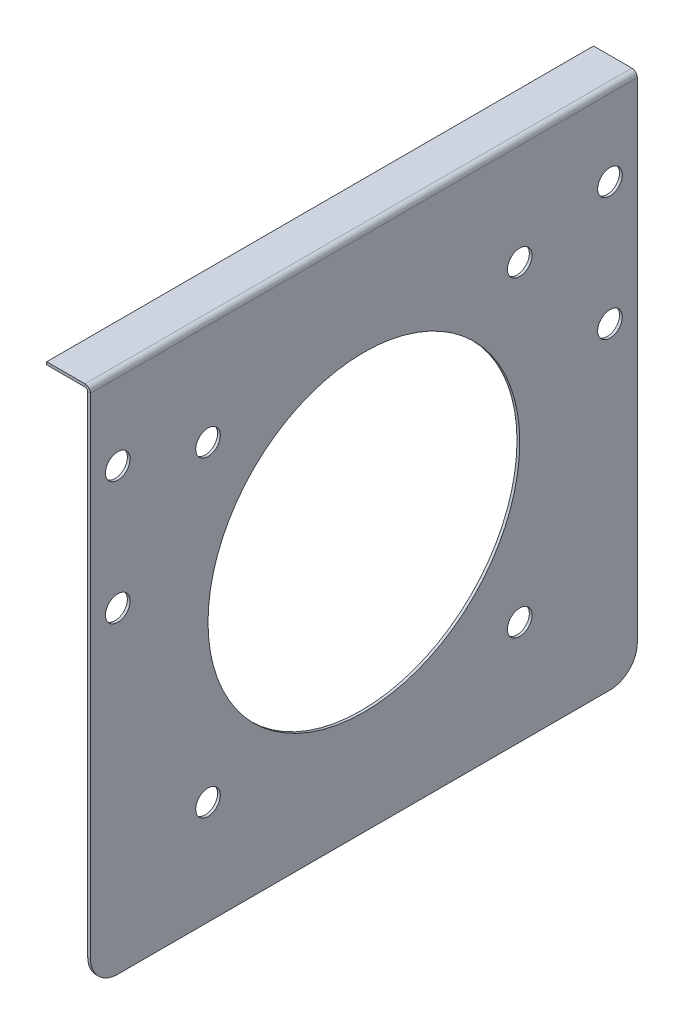
from build123d import *

# Parameters (mm, degrees)
CROQUIS1_R                       = 57
SALIENTE_EXTRUIR1_DEPTH          = 15
VACIADO1_T                       = 1
DESPLEGAR_PLIEGUES1_OUTLINE_W    = 1
DESPLEGAR_PLIEGUES1_OUTLINE_H    = 200
DESPLEGAR_PLIEGUES1_DEPTH        = 15
DESPLEGAR_START                  = 15
DESPLEGAR_PLIEGUES1_2_OUTLINE_W  = 14.35619449
DESPLEGAR_PLIEGUES1_2_OUTLINE_H  = 200
DESPLEGAR_PLIEGUES1_2_DEPTH      = 1
PROCESAR_START                   = -100
PROCESAR_PLIEGUES1_DEPTH         = 200
PROCESAR_PLIEGUES1_2_DEPTH       = 200
TALADRO_DE_MARGEN_PARA_M83_D     = 9
TALADRO_DE_MARGEN_PARA_M84_D     = 9
TALADRO_DE_MARGEN_PARA_M84_DEPTH = 15.42
TALADRO_DE_MARGEN_PARA_M85_D     = 9
TALADRO_DE_MARGEN_PARA_M85_DEPTH = 1.999


# Read off the part's stored shape, not the designer's step: Desplegar pliegues1, Procesar pliegues1
with BuildPart() as part:
    # Croquis1 → Saliente-Extruir1 (new body)
    with BuildSketch(Plane(origin=(0, 0, 0), x_dir=(0, 0, -1), z_dir=(1, 0, 0))):
        with BuildLine():
            Line((-100, 0), (100, 0))
            Line((100, 0), (100, -180))
            ThreePointArc((100, -180), (97.071067812, -187.071067812), (90, -190))
            Line((90, -190), (-90, -190))
            ThreePointArc((-90, -190), (-97.071067812, -187.071067812), (-100, -180))
            Line((-100, -180), (-100, 0))
        make_face()
        with Locations((0, -95)):
            Circle(CROQUIS1_R, mode=Mode.SUBTRACT)
    extrude(amount=SALIENTE_EXTRUIR1_DEPTH)

    # Vaciado1
    vaciado1_openings = [part.faces().sort_by_distance(p)[0] for p in [
        (7.5, -90, -100),
        (7.5, -187.071067812, -97.071067812),
        (7.5, -190, 0),
        (7.5, -187.071067812, 97.071067812),
        (7.5, -90, 100),
        (7.5, -95, 57),
        (0, -2.758622845, 0),
    ]]
    offset(amount=VACIADO1_T, openings=vaciado1_openings, kind=Kind.INTERSECTION)

    # Desplegar pliegues1 outline → Desplegar pliegues1 (cut)
    with BuildSketch(Plane.YZ):
        with Locations((0.5, 0)):
            Rectangle(DESPLEGAR_PLIEGUES1_OUTLINE_W, DESPLEGAR_PLIEGUES1_OUTLINE_H)
    extrude(amount=DESPLEGAR_PLIEGUES1_DEPTH, mode=Mode.SUBTRACT)

    # Desplegar pliegues1 2 outline → Desplegar pliegues1 2 (add)
    with BuildSketch(Plane.YZ.offset(DESPLEGAR_START)):
        with Locations((8.178097245, 0)):
            Rectangle(DESPLEGAR_PLIEGUES1_2_OUTLINE_W, DESPLEGAR_PLIEGUES1_2_OUTLINE_H)
    extrude(amount=DESPLEGAR_PLIEGUES1_2_DEPTH)

    # Procesar pliegues1 outline → Procesar pliegues1 (cut)
    with BuildSketch(Plane.XY.offset(PROCESAR_START)):
        with BuildLine():
            Line((15, 15.35619449), (15, 0.732050807))
            ThreePointArc((15, 0.732050807), (15.732050807, 0), (16, -1))
            Line((16, -1), (16, 15.35619449))
            Line((16, 15.35619449), (15, 15.35619449))
        make_face()
    extrude(amount=PROCESAR_PLIEGUES1_DEPTH, mode=Mode.SUBTRACT)

    # Procesar pliegues1 2 outline → Procesar pliegues1 2 (add)
    with BuildSketch(Plane.XY.offset(PROCESAR_START)):
        with BuildLine():
            Line((14, 1), (0, 1))
            Line((0, 1), (0, 0))
            Line((0, 0), (14, 0))
            ThreePointArc((14, 0), (14.707106781, -0.292893219), (15, -1))
            Line((15, -1), (15, 0.732050807))
            ThreePointArc((15, 0.732050807), (14.51763809, 0.931851652), (14, 1))
        make_face()
    extrude(amount=PROCESAR_PLIEGUES1_2_DEPTH)

    # Taladro de margen para M83 (through all)
    with Locations(Plane(origin=(15, -102.41730184, -252.760845032), x_dir=(0, 0, 1), z_dir=(-1, 0, 0))):
        with Locations((162.760845032, 73.414694032), (162.760845032, 28.414694032), (342.760845032, 73.414694032), (342.760845032, 28.414694032)):
            Hole(TALADRO_DE_MARGEN_PARA_M83_D / 2)

    # Taladro de margen para M84
    with Locations(Plane(origin=(15, -102.41730184, -252.760845032), x_dir=(0, 0, 1), z_dir=(-1, 0, 0))):
        with Locations((195.760845032, 64.41730184), (309.760845032, 64.41730184)):
            Hole(TALADRO_DE_MARGEN_PARA_M84_D / 2, depth=TALADRO_DE_MARGEN_PARA_M84_DEPTH)

    # Taladro de margen para M85
    with Locations(Plane(origin=(15, -102.41730184, -252.760845032), x_dir=(0, 0, 1), z_dir=(-1, 0, 0))):
        with Locations((309.760845032, -49.58269816), (195.760845032, -49.58269816)):
            Hole(TALADRO_DE_MARGEN_PARA_M85_D / 2, depth=TALADRO_DE_MARGEN_PARA_M85_DEPTH)


solid = part.part
